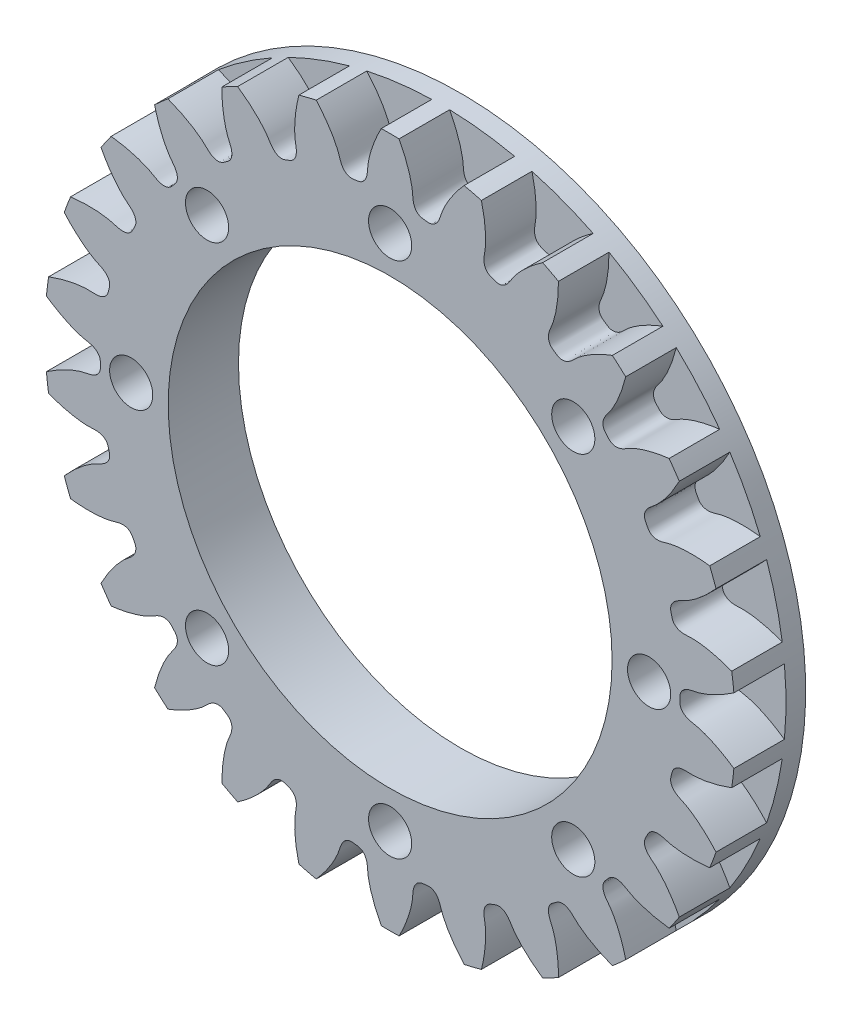
from build123d import *

# Parameters (mm, degrees)
SKETCHREVOLVESPURGEAR2_W       = 4.2
SKETCHREVOLVESPURGEAR2_H       = 27.999999579
TOOTHEXTRUDECUTSPURGEAR2_START = -2
TOOTHEXTRUDECUTSPURGEAR2_DEPTH = 4.1
PATTERNSPURGEAR2_COUNT         = 26
BOREREVOLVESKETCH_W            = 4.2
BOREREVOLVESKETCH_H            = 18
SKETCH1_R                      = 1.75
CUT_EXTRUDE1_DEPTH             = 40.820094989
BOSS_EXTRUDE1_START            = 1.5
SKETCH2_R                      = 28
SKETCH2_R_2                    = 1.75
SKETCH2_R_3                    = 18
BOSS_EXTRUDE1_DEPTH            = 1.5


with BuildPart() as part:
    # SketchRevolveSpurGear2 → SpurGear2 (revolve)
    with BuildSketch(Plane(origin=(0, 0, 0), x_dir=(0, 0, -1), z_dir=(1, 0, 0))):
        with Locations((0, 13.99999979)):
            Rectangle(SKETCHREVOLVESPURGEAR2_W, SKETCHREVOLVESPURGEAR2_H)
    revolve(axis=Axis((0, 0, 0), (0, 0, -1)))

    # SketchToothSpurGear2 → ToothExtrudeCutSpurGear2 (cut)
    with BuildSketch(Plane.XY.offset(TOOTHEXTRUDECUTSPURGEAR2_START)):
        with BuildLine():
            ThreePointArc((27.967931097, 2.721177403), (28.099999578, 0), (27.967931097, -2.721177403))
            add(Edge.make_bspline(
                [(27.967931097, -2.721177403), (27.763754051, -2.577368906), (27.45988226, -2.375317635), (27.054718448, -2.130765319), (26.771509076, -1.970609362), (26.501301853, -1.827769561), (26.244837865, -1.70137092), (26.00281878, -1.590510389), (25.775905859, -1.494258687), (25.564719047, -1.411662356), (25.369836149, -1.341743455), (25.191791925, -1.283507464), (25.031077705, -1.235924829), (24.888139619, -1.19799606), (24.76338134, -1.16855779), (24.569503314, -1.128978605), (24.379567001, -1.099847364), (24.197111023, -1.042982032), (24.096768354, -1.005131229), (23.999822959, -0.96026325), (23.905324291, -0.906606617), (23.812530635, -0.841088441), (23.721549507, -0.759218173), (23.634910547, -0.655094209), (23.559449145, -0.523238068), (23.512243469, -0.373005461), (23.493324541, -0.194778458), (23.503961819, 0), (23.493324541, 0.194778458), (23.512243469, 0.373005461), (23.559449145, 0.523238068), (23.634910547, 0.655094209), (23.721549507, 0.759218173), (23.812530635, 0.841088441), (23.905324291, 0.906606617), (23.999822959, 0.96026325), (24.096768354, 1.005131229), (24.197111023, 1.042982032), (24.379567001, 1.099847364), (24.569503314, 1.128978605), (24.76338134, 1.16855779), (24.888139619, 1.19799606), (25.031077705, 1.235924829), (25.191791925, 1.283507464), (25.369836149, 1.341743455), (25.564719047, 1.411662356), (25.775905859, 1.494258687), (26.00281878, 1.590510389), (26.244837865, 1.70137092), (26.501301853, 1.827769561), (26.771509076, 1.970609362), (27.054718448, 2.130765319), (27.45988226, 2.375317635), (27.763754051, 2.577368906), (27.967931097, 2.721177403)],
                knots=[0, 0, 0, 0, 0.067678545, 0.098846296, 0.128233033, 0.155838755, 0.181663463, 0.205707157, 0.227969837, 0.248451502, 0.267152153, 0.284071789, 0.299210412, 0.31256802, 0.324144614, 0.333940193, 0.36620217, 0.376043063, 0.385676334, 0.395249242, 0.40496248, 0.415086991, 0.425974801, 0.438038627, 0.45164696, 0.466884901, 0.480343723, 0.5, 0.519656277, 0.533115099, 0.54835304, 0.561961373, 0.574025199, 0.584913009, 0.59503752, 0.604750758, 0.614323666, 0.623956937, 0.63379783, 0.666059807, 0.675855386, 0.68743198, 0.700789588, 0.715928211, 0.732847847, 0.751548498, 0.772030163, 0.794292843, 0.818336537, 0.844161245, 0.871766967, 0.901153704, 0.932321455, 1, 1, 1, 1], degree=3))
        make_face()
    toothextrudecutspurgear2 = extrude(amount=TOOTHEXTRUDECUTSPURGEAR2_DEPTH, mode=Mode.SUBTRACT)

    # PatternSpurGear2: ToothExtrudeCutSpurGear2 ×26 about axis
    patternspurgear2_axis = Axis((0, 0, 55), (0, 0, -1))
    for i in range(1, PATTERNSPURGEAR2_COUNT):
        add(toothextrudecutspurgear2.rotate(patternspurgear2_axis, i * 360 / PATTERNSPURGEAR2_COUNT), mode=Mode.SUBTRACT)

    # BoreRevolveSketch → BoreRevolveCut (revolve, cut)
    with BuildSketch(Plane(origin=(0, 0, 0), x_dir=(0, 0, -1), z_dir=(1, 0, 0))):
        with Locations((0, 9)):
            Rectangle(BOREREVOLVESKETCH_W, BOREREVOLVESKETCH_H)
    revolve(axis=Axis((0, 0, 0), (0, 0, -1)), mode=Mode.SUBTRACT)

    # Sketch1 → Cut-Extrude1 (cut, through all)
    with BuildSketch(Plane(origin=(0, 0, -2.1), x_dir=(-1, 0, 0), z_dir=(0, 0, -1))):
        with Locations((0, 21)):
            Circle(SKETCH1_R)
        with Locations((14.849242405, 14.849242405)):
            Circle(SKETCH1_R)
        with Locations((21, 0)):
            Circle(SKETCH1_R)
        with Locations((14.849242405, -14.849242405)):
            Circle(SKETCH1_R)
        with Locations((0, -21)):
            Circle(SKETCH1_R)
        with Locations((-14.849242405, -14.849242405)):
            Circle(SKETCH1_R)
        with Locations((-21, 0)):
            Circle(SKETCH1_R)
        with Locations((-14.849242405, 14.849242405)):
            Circle(SKETCH1_R)
    extrude(amount=-CUT_EXTRUDE1_DEPTH, mode=Mode.SUBTRACT)

    # Sketch2 → Boss-Extrude1 (add)
    with BuildSketch(Plane(origin=(0, 0, -2.1), x_dir=(-1, 0, 0), z_dir=(0, 0, -1)).offset(BOSS_EXTRUDE1_START)):
        Circle(SKETCH2_R)
        with Locations((14.849242405, -14.849242405)):
            Circle(SKETCH2_R_2, mode=Mode.SUBTRACT)
        with Locations((0, -21)):
            Circle(SKETCH2_R_2, mode=Mode.SUBTRACT)
        with Locations((-14.849242405, -14.849242405)):
            Circle(SKETCH2_R_2, mode=Mode.SUBTRACT)
        with Locations((-21, 0)):
            Circle(SKETCH2_R_2, mode=Mode.SUBTRACT)
        with Locations((-14.849242405, 14.849242405)):
            Circle(SKETCH2_R_2, mode=Mode.SUBTRACT)
        with Locations((0, 21)):
            Circle(SKETCH2_R_2, mode=Mode.SUBTRACT)
        with Locations((14.849242405, 14.849242405)):
            Circle(SKETCH2_R_2, mode=Mode.SUBTRACT)
        with Locations((21, 0)):
            Circle(SKETCH2_R_2, mode=Mode.SUBTRACT)
        Circle(SKETCH2_R_3, mode=Mode.SUBTRACT)
    extrude(amount=-BOSS_EXTRUDE1_DEPTH)


solid = part.part
